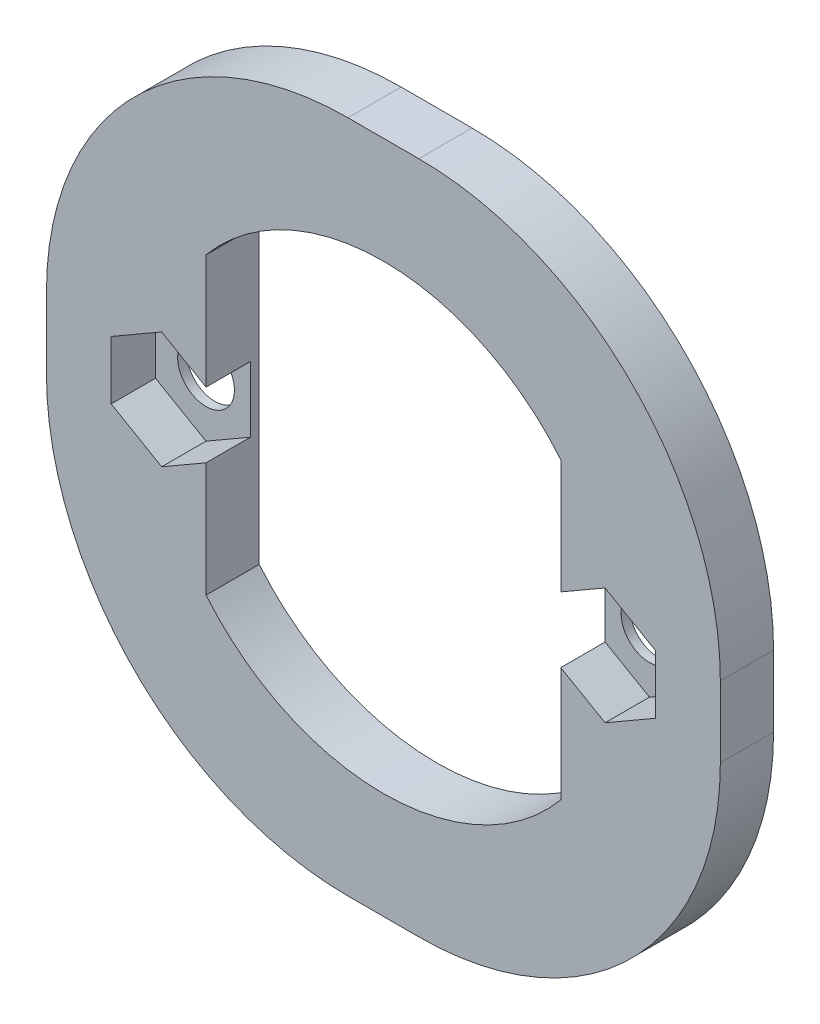
from build123d import *

# Parameters (mm, degrees)
BOSS_EXTRUDE5_DEPTH = 3
SKETCH2_R           = 1.6
CUT_EXTRUDE2_DEPTH  = 28.035531037
CUT_EXTRUDE3_DEPTH  = 2.5


with BuildPart() as part:
    # Sketch1 → Boss-Extrude5 (new body)
    with BuildSketch(Plane.XY):
        with BuildLine():
            ThreePointArc((-18.997893001, -2), (-14.018708281, -14.02081528), (-1.997893001, -19))
            Line((-1.997893001, -19), (1.997893001, -19))
            ThreePointArc((1.997893001, -19), (14.018708281, -14.02081528), (18.997893001, -2))
            Line((18.997893001, -2), (18.997893001, 2))
            ThreePointArc((18.997893001, 2), (14.018708281, 14.02081528), (1.997893001, 19))
            Line((1.997893001, 19), (-1.997893001, 19))
            ThreePointArc((-1.997893001, 19), (-14.018708281, 14.02081528), (-18.997893001, 2))
            Line((-18.997893001, 2), (-18.997893001, -2))
        make_face()
        with BuildLine():
            ThreePointArc((10, -8.306623863), (0, -13), (-10, -8.306623863))
            Line((-10, -8.306623863), (-10, 8.306623863))
            ThreePointArc((-10, 8.306623863), (0, 13), (10, 8.306623863))
            Line((10, 8.306623863), (10, -8.306623863))
        make_face(mode=Mode.SUBTRACT)
    extrude(amount=BOSS_EXTRUDE5_DEPTH)

    # Sketch2 → Cut-Extrude2 (cut, through all)
    with BuildSketch(Plane.XY.offset(3)):
        with Locations((-12.5, 0)):
            Circle(SKETCH2_R)
        with Locations((12.5, 0)):
            Circle(SKETCH2_R)
    extrude(amount=-CUT_EXTRUDE2_DEPTH, mode=Mode.SUBTRACT)

    # Sketch3 → Cut-Extrude3 (cut)
    with BuildSketch(Plane.XY.offset(3)):
        Polygon((-12.5, 3.290896534), (-15.35, 1.645448267), (-15.35, -1.645448267), (-12.5, -3.290896534), (-9.65, -1.645448267), (-9.65, 1.645448267), align=None)
        Polygon((12.5, 3.290896534), (9.65, 1.645448267), (9.65, -1.645448267), (12.5, -3.290896534), (15.35, -1.645448267), (15.35, 1.645448267), align=None)
    extrude(amount=-CUT_EXTRUDE3_DEPTH, mode=Mode.SUBTRACT)


solid = part.part
